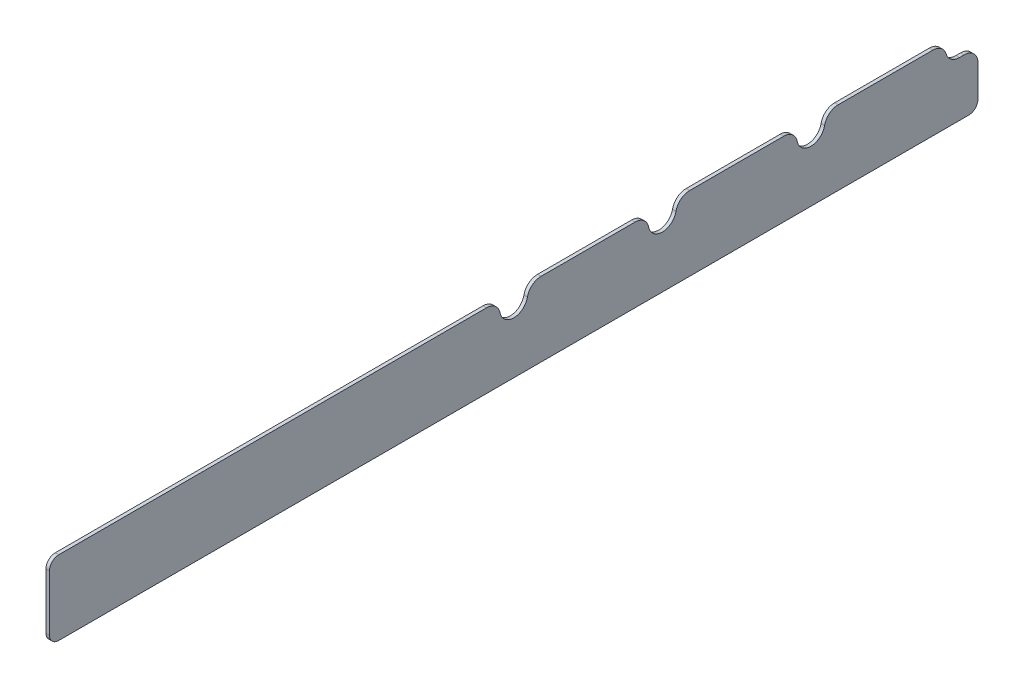
from build123d import *

# Parameters (mm, degrees)
SKETCH1_W              = 317.5
SKETCH1_H              = 25.4
BASE_FLANGE1_DEPTH     = 1.1938
FILLET1_R              = 3.175
CUT_EXTRUDE1_DEPTH     = 160.261664121
FILLET2_R              = 4.7625
LPATTERN2_COUNT        = 3
LPATTERN2_PITCH        = 50.8
FILLET2_OF_LPATTERN2_R = 4.7625
CUT_EXTRUDE2_DEPTH     = 160.261664229
FILLET3_R              = 4.7625


# Sheet-metal steps are written as plain solids
with BuildPart() as part:
    # Sketch1 → Base-Flange1 (new body)
    with BuildSketch(Plane(origin=(0, 0, 0), x_dir=(0, 0, -1), z_dir=(1, 0, 0))):
        Rectangle(SKETCH1_W, SKETCH1_H)
    extrude(amount=-BASE_FLANGE1_DEPTH)

    # Fillet1
    fillet1_edges = [part.edges().sort_by_distance(p)[0] for p in [
        (-0.5969, -12.7, -158.75),
        (-0.5969, -12.7, 158.75),
        (-0.5969, 12.7, 158.75),
        (-0.5969, 12.7, -158.75),
    ]]
    fillet(fillet1_edges, radius=FILLET1_R)

    # Sketch2 → Cut-Extrude1 (cut, through all)
    with BuildSketch(Plane.ZY.offset(1.1938)):
        with BuildLine():
            Line((-4.7625, 9.8298), (-4.7625, 12.7))
            Line((-4.7625, 12.7), (4.7625, 12.7))
            Line((4.7625, 12.7), (4.7625, 9.8298))
            ThreePointArc((4.7625, 9.8298), (0, 5.0673), (-4.7625, 9.8298))
        make_face()
    cut_extrude1 = extrude(amount=-CUT_EXTRUDE1_DEPTH, mode=Mode.SUBTRACT)

    # Fillet2
    fillet2_edges = [part.edges().sort_by_distance(p)[0] for p in [
        (-0.5969, 12.7, 4.7625),
        (-0.5969, 12.7, -4.7625),
    ]]
    fillet(fillet2_edges, radius=FILLET2_R)

    # LPattern2: Cut-Extrude1 ×3
    with Locations(*[(0, 0, -i * LPATTERN2_PITCH) for i in range(1, LPATTERN2_COUNT)]):
        add(cut_extrude1, mode=Mode.SUBTRACT)

    # Fillet2 of LPattern2
    fillet2_of_lpattern2_edges = [part.edges().sort_by_distance(p)[0] for p in [
        (-0.5969, 12.7, -46.0375),
        (-0.5969, 12.7, -55.5625),
        (-0.5969, 12.7, -96.8375),
        (-0.5969, 12.7, -106.3625),
    ]]
    fillet(fillet2_of_lpattern2_edges, radius=FILLET2_OF_LPATTERN2_R)

    # Sketch3 → Cut-Extrude2 (cut, through all)
    with BuildSketch(Plane.ZY.offset(1.1938)):
        with BuildLine():
            Line((-152.4, 5.951169638), (-158.75, 5.951169638))
            Line((-158.75, 5.951169638), (-158.75, 9.525))
            ThreePointArc((-158.75, 9.525), (-157.82006403, 11.77006403), (-155.575, 12.7))
            Line((-155.575, 12.7), (-147.6375, 12.7))
            Line((-147.6375, 12.7), (-147.6375, 10.713669638))
            ThreePointArc((-147.6375, 10.713669638), (-149.032403955, 7.346073593), (-152.4, 5.951169638))
        make_face()
    extrude(amount=-CUT_EXTRUDE2_DEPTH, mode=Mode.SUBTRACT)

    # Fillet3
    fillet3_edges = [part.edges().sort_by_distance(p)[0] for p in [
        (-0.5969, 5.951169638, -158.75),
        (-0.5969, 12.7, -147.6375),
    ]]
    fillet(fillet3_edges, radius=FILLET3_R)


solid = part.part
